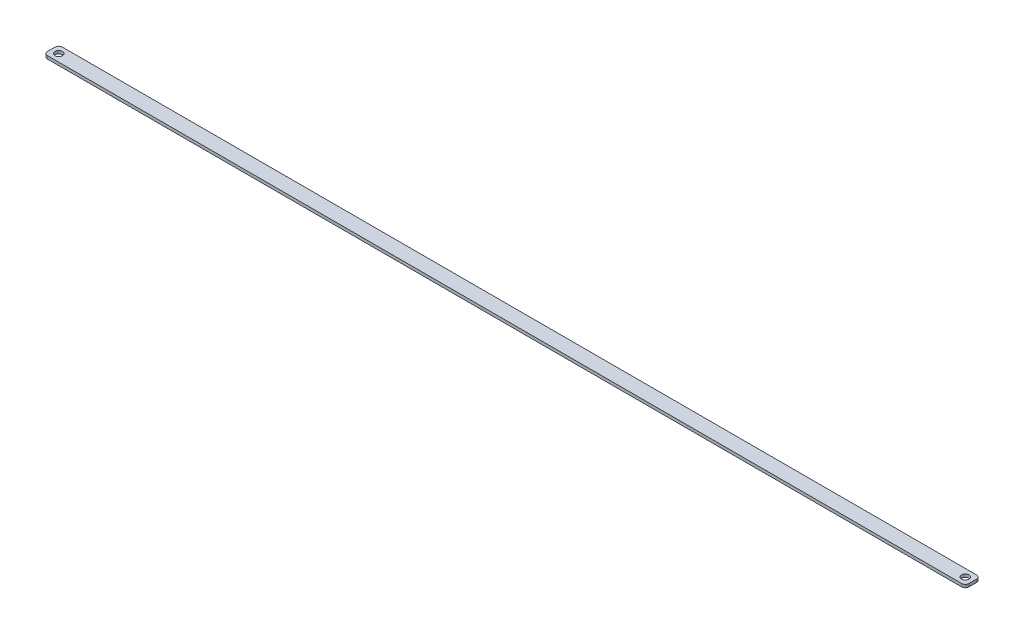
from build123d import *

# Parameters (mm, degrees)
SKETCH1_R           = 2.5
BOSS_EXTRUDE2_DEPTH = 2
FLEX1_OUTLINE_R     = 2.5
FLEX1_DEPTH         = 2


# Read off the part's stored shape, not the designer's step: Flex1
with BuildPart() as part:
    # Sketch1 → Boss-Extrude2 (new body)
    with BuildSketch(Plane(origin=(0, 0, 0), x_dir=(1, 0, 0), z_dir=(0, 1, 0))):
        with BuildLine():
            Line((2.5, 0), (47.5, 0))
            ThreePointArc((47.5, 0), (49.267766953, 0.732233047), (50, 2.5))
            Line((50, 2.5), (50, 7.5))
            ThreePointArc((50, 7.5), (49.267766953, 9.267766953), (47.5, 10))
            Line((47.5, 10), (2.5, 10))
            ThreePointArc((2.5, 10), (0.732233047, 9.267766953), (0, 7.5))
            Line((0, 7.5), (0, 2.5))
            ThreePointArc((0, 2.5), (0.732233047, 0.732233047), (2.5, 0))
        make_face()
        with Locations(Location((5, 5, 0), (0, 0, 270))):
            Circle(SKETCH1_R, mode=Mode.SUBTRACT)
        with Locations(Location((45, 5, 0), (0, 0, 270))):
            Circle(SKETCH1_R, mode=Mode.SUBTRACT)
    extrude(amount=BOSS_EXTRUDE2_DEPTH)

    # Flex1 outline → Flex1 (add)
    # profile 1 of 4: a face of its own
    with BuildSketch(Plane(origin=(0, 0, 0), x_dir=(1, 0, 0), z_dir=(0, 1, 0))):
        with BuildLine():
            Line((2.5, 10), (-275.129385693, 10))
            ThreePointArc((-275.129385693, 10), (-276.897152646, 9.267766953), (-277.629385693, 7.5))
            Line((-277.629385693, 7.5), (-277.629385693, 2.5))
            ThreePointArc((-277.629385693, 2.5), (-276.897152646, 0.732233047), (-275.129385693, 0))
            Line((-275.129385693, 0), (2.5, 0))
            ThreePointArc((2.5, 0), (0.732233047, 0.732233047), (0, 2.5))
            Line((0, 2.5), (0, 7.5))
            ThreePointArc((0, 7.5), (0.732233047, 9.267766953), (2.5, 10))
        make_face()
        with Locations((-272.629385693, 5)):
            Circle(FLEX1_OUTLINE_R, mode=Mode.SUBTRACT)
    # profile 2 of 4: a face of its own
    with BuildSketch(Plane(origin=(0, 0, 0), x_dir=(1, 0, 0), z_dir=(0, 1, 0))):
        with BuildLine():
            Line((338.870614307, 10), (47.5, 10))
            ThreePointArc((47.5, 10), (49.267766953, 9.267766953), (50, 7.5))
            Line((50, 7.5), (50, 2.5))
            ThreePointArc((50, 2.5), (49.267766953, 0.732233047), (47.5, 0))
            Line((47.5, 0), (338.870614307, 0))
            ThreePointArc((338.870614307, 0), (340.63838126, 0.732233047), (341.370614307, 2.5))
            Line((341.370614307, 2.5), (341.370614307, 7.5))
            ThreePointArc((341.370614307, 7.5), (340.63838126, 9.267766953), (338.870614307, 10))
        make_face()
        with Locations((336.370614307, 5)):
            Circle(FLEX1_OUTLINE_R, mode=Mode.SUBTRACT)
    # profile 3 of 4: a face of its own
    with BuildSketch(Plane(origin=(0, 0, 0), x_dir=(1, 0, 0), z_dir=(0, 1, 0))):
        with Locations((5, 5)):
            Circle(FLEX1_OUTLINE_R)
    # profile 4 of 4: a face of its own
    with BuildSketch(Plane(origin=(0, 0, 0), x_dir=(1, 0, 0), z_dir=(0, 1, 0))):
        with Locations((45, 5)):
            Circle(FLEX1_OUTLINE_R)
    extrude(amount=FLEX1_DEPTH)


solid = part.part
